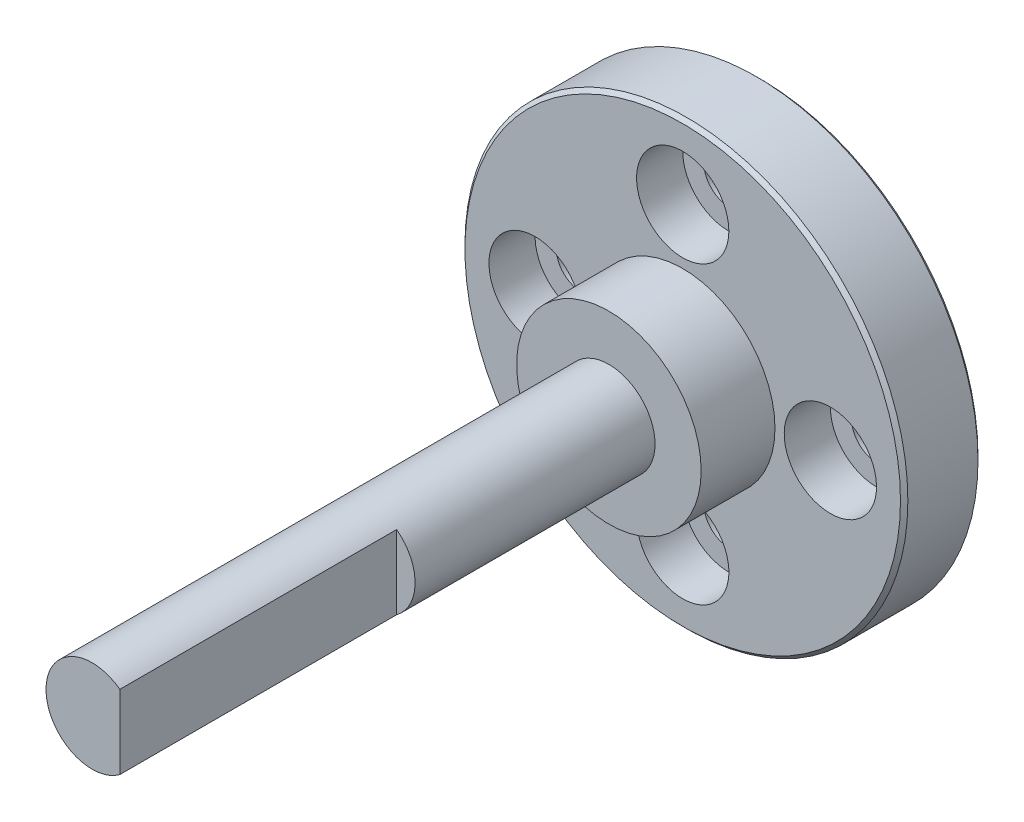
from build123d import *

# Parameters (mm, degrees)
SKETCH_1_R                     = 12
SKETCH_1_R_2                   = 3
EXTRUDE_1_DEPTH                = 4.2
SKETCH_2_R                     = 5
EXTRUDE_2_DEPTH                = 4
HOLE_WIZARD_M2_5_1_D           = 2.7
HOLE_WIZARD_M2_5_1_CBORE_D     = 5
HOLE_WIZARD_M2_5_1_CBORE_DEPTH = 2.5
PATTERN_CIRCULAR_1_COUNT       = 4
EXTRUDE_START                  = 2
SKETCH_10_R                    = 3
EXTRUDE_5_DEPTH                = 2
CHAMFER_3_SIZE                 = 0.2
SKETCH_12_R                    = 2.5
EXTRUDE_6_DEPTH                = 28
CUT_EXTRUDE_START              = -15
CUT_EXTRUDE_1_DEPTH            = 15


with BuildPart() as part:
    # 草图1 → 凸台-拉伸1 (new body)
    with BuildSketch(Plane.XY):
        Circle(SKETCH_1_R)
        Circle(SKETCH_1_R_2, mode=Mode.SUBTRACT)
    extrude(amount=EXTRUDE_1_DEPTH)

    # 草图2 → 凸台-拉伸2 (add)
    with BuildSketch(Plane.XY.offset(4.2)):
        Circle(SKETCH_2_R)
    extrude(amount=EXTRUDE_2_DEPTH)

    # M2.5 六角圆柱头螺钉的柱形沉头孔1 (through all)
    with Locations(Plane.XY.offset(4.2)):
        with Locations((0, 8)):
            hole_wizard_m2_5_1 = CounterBoreHole(HOLE_WIZARD_M2_5_1_D / 2, HOLE_WIZARD_M2_5_1_CBORE_D / 2, HOLE_WIZARD_M2_5_1_CBORE_DEPTH)

    # 阵列(圆周)1: M2.5 六角圆柱头螺钉的柱形沉头孔1 ×4 about axis
    pattern_circular_1_axis = Axis((0, 0, 4.2), (0, 0, -1))
    for i in range(1, PATTERN_CIRCULAR_1_COUNT):
        add(hole_wizard_m2_5_1.rotate(pattern_circular_1_axis, i * 360 / PATTERN_CIRCULAR_1_COUNT), mode=Mode.SUBTRACT)

    # 草图10 → 凸台-拉伸5 (add)
    with BuildSketch(Plane(origin=(0, 0, 4.2), x_dir=(-1, 0, 0), z_dir=(0, 0, -1)).offset(EXTRUDE_START)):
        Circle(SKETCH_10_R)
    extrude(amount=-EXTRUDE_5_DEPTH)

    # 倒角3
    chamfer_3_edges = [part.edges().sort_by_distance(p)[0] for p in [
        (-12, 0, 0),
        (-12, 0, 4.2),
    ]]
    chamfer(chamfer_3_edges, length=CHAMFER_3_SIZE)

    # 草图12 → 凸台-拉伸6 (add)
    with BuildSketch(Plane.XY.offset(8.2)):
        Circle(SKETCH_12_R)
    extrude(amount=EXTRUDE_6_DEPTH)

    # 草图13 → 切除-拉伸1 (cut)
    with BuildSketch(Plane.XY.offset(36.2).offset(CUT_EXTRUDE_START)):
        with BuildLine():
            Line((1.5, 2), (1.5, -2))
            ThreePointArc((1.5, -2), (2.5, 0), (1.5, 2))
        make_face()
    extrude(amount=CUT_EXTRUDE_1_DEPTH, mode=Mode.SUBTRACT)


solid = part.part
